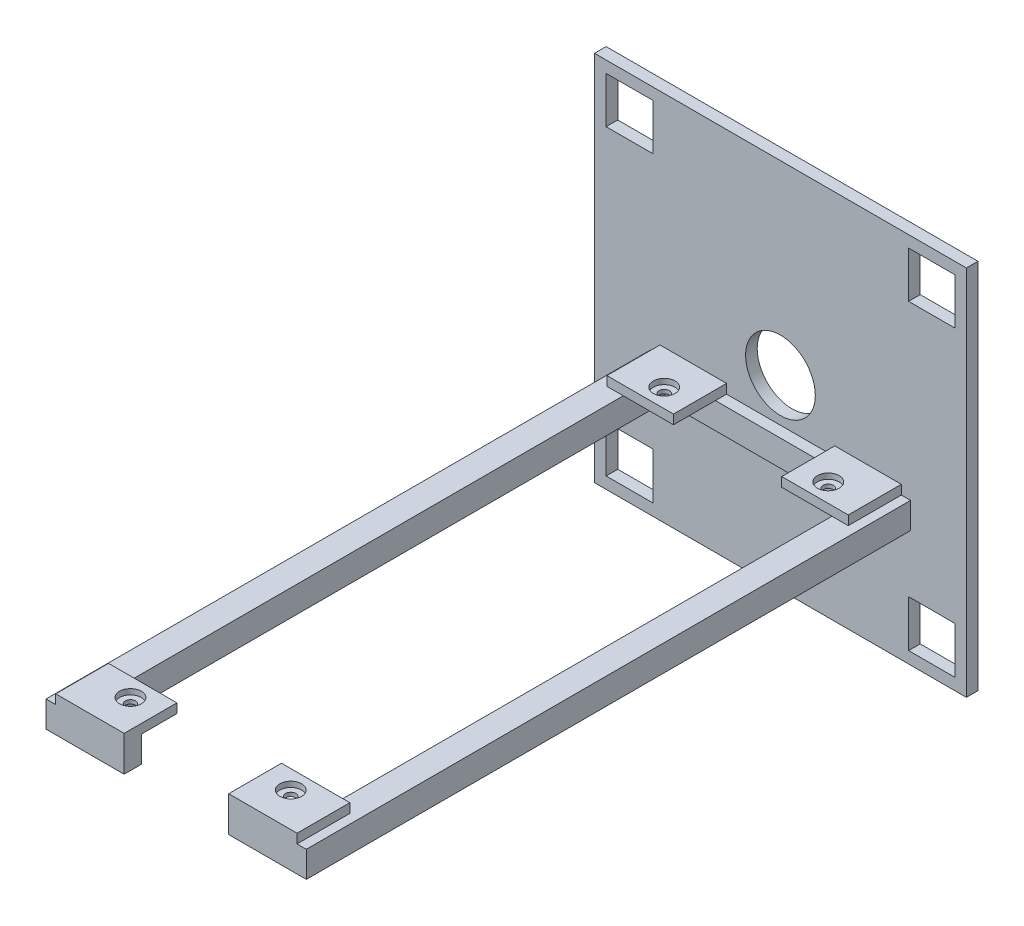
from build123d import *

# Parameters (mm, degrees)
SKETCH1_W                                           = 101.6
SKETCH1_H                                           = 101.6
BOSS_EXTRUDE1_DEPTH                                 = 3.175
SKETCH2_W                                           = 7.122890289
SKETCH2_H                                           = 7.136197002
SKETCH2_W_2                                         = 6.990922099
BOSS_EXTRUDE2_DEPTH                                 = 165.1
SKETCH3_W                                           = 57.007584612
SKETCH3_H                                           = 7.136197002
BOSS_EXTRUDE3_DEPTH                                 = 3.048
SKETCH6_W                                           = 4.833876033
SKETCH6_H                                           = 7.136197002
BOSS_EXTRUDE6_DEPTH                                 = 14.224
SKETCH7_W                                           = 4.744591934
SKETCH7_H                                           = 7.136197002
BOSS_EXTRUDE7_DEPTH                                 = 14.224
SKETCH12_W                                          = 18.683796336
SKETCH12_H                                          = 14.429225703
SKETCH12_W_2                                        = 18.700629735
SKETCH12_W_3                                        = 18.193899735
SKETCH12_H_2                                        = 14.497437443
SKETCH12_W_4                                        = 18.175923336
BOSS_EXTRUDE10_DEPTH                                = 2.54
CBORE_FOR_3_BINDING_HEAD_MACHINE_SCREW2_D           = 2.794
CBORE_FOR_3_BINDING_HEAD_MACHINE_SCREW2_CBORE_D     = 5.95376
CBORE_FOR_3_BINDING_HEAD_MACHINE_SCREW2_CBORE_DEPTH = 1.4986
SKETCH19_W                                          = 12.75921203
SKETCH19_H                                          = 12.60998148
SKETCH19_W_2                                        = 12.60998148
SKETCH19_H_2                                        = 12.75921203
CUT_EXTRUDE1_DEPTH                                  = 3.175
F_3_4_0_75_DIAMETER_HOLE1_D                         = 19.05


with BuildPart() as part:
    # Sketch1 → Boss-Extrude1 (new body)
    with BuildSketch(Plane.XY):
        with Locations((52.482861157, 13.097719286)):
            Rectangle(SKETCH1_W, SKETCH1_H)
    extrude(amount=BOSS_EXTRUDE1_DEPTH)

    # Sketch2 → Boss-Extrude2 (add)
    with BuildSketch(Plane.XY.offset(3.175)):
        with Locations((20.483036302, -2.281379215)):
            Rectangle(SKETCH2_W, SKETCH2_H)
        with Locations((84.547527108, -2.281379215)):
            Rectangle(SKETCH2_W_2, SKETCH2_H)
    extrude(amount=BOSS_EXTRUDE2_DEPTH)

    # Sketch3 → Boss-Extrude3 (add)
    with BuildSketch(Plane.XY.offset(3.175)):
        with Locations((52.548273752, -2.281379215)):
            Rectangle(SKETCH3_W, SKETCH3_H)
    extrude(amount=BOSS_EXTRUDE3_DEPTH)

    # Sketch6 → Boss-Extrude6 (add)
    with BuildSketch(Plane.ZY.offset(-81.052066058)):
        with Locations((165.858061984, -2.281379215)):
            Rectangle(SKETCH6_W, SKETCH6_H)
    extrude(amount=BOSS_EXTRUDE6_DEPTH)

    # Sketch7 → Boss-Extrude7 (add)
    with BuildSketch(Plane(origin=(24.044481446, 0, 0), x_dir=(0, 0, -1), z_dir=(1, 0, 0))):
        with Locations((-165.902704033, -2.281379215)):
            Rectangle(SKETCH7_W, SKETCH7_H)
    extrude(amount=BOSS_EXTRUDE7_DEPTH)

    # Sketch12 → Boss-Extrude10 (add)
    with BuildSketch(Plane(origin=(0, 1.286719286, 0), x_dir=(1, 0, 0), z_dir=(0, 1, 0))):
        with Locations((76.169964226, -161.060387149)):
            Rectangle(SKETCH12_W, SKETCH12_H)
        with Locations((28.918166579, -161.060387149)):
            Rectangle(SKETCH12_W_2, SKETCH12_H)
        with Locations((28.664801579, -10.423718722)):
            Rectangle(SKETCH12_W_3, SKETCH12_H_2)
        with Locations((76.423900726, -10.423718722)):
            Rectangle(SKETCH12_W_4, SKETCH12_H_2)
    extrude(amount=BOSS_EXTRUDE10_DEPTH)

    # CBORE for #3 Binding Head Machine Screw2 (through all)
    with Locations(Plane(origin=(0, 3.826719286, 0), x_dir=(1, 0, 0), z_dir=(0, 1, 0))):
        with Locations((30.648481446, -158.925774297), (74.448066058, -158.925774297), (30.141751446, -12.592437443), (74.955939058, -12.592437443)):
            CounterBoreHole(CBORE_FOR_3_BINDING_HEAD_MACHINE_SCREW2_D / 2, CBORE_FOR_3_BINDING_HEAD_MACHINE_SCREW2_CBORE_D / 2, CBORE_FOR_3_BINDING_HEAD_MACHINE_SCREW2_CBORE_DEPTH)

    # Sketch19 → Cut-Extrude1 (cut)
    with BuildSketch(Plane.XY.offset(3.175)):
        with Locations((11.237467172, 54.417728546)):
            Rectangle(SKETCH19_W, SKETCH19_H)
        with Locations((93.802870417, -28.147674699)):
            Rectangle(SKETCH19_W_2, SKETCH19_H_2)
        with Locations((93.802870417, 54.417728546)):
            Rectangle(SKETCH19_W_2, SKETCH19_H)
        with Locations((11.237467172, -28.147674699)):
            Rectangle(SKETCH19_W, SKETCH19_H_2)
    extrude(amount=-CUT_EXTRUDE1_DEPTH, mode=Mode.SUBTRACT)

    # 3/4 (0.75) Diameter Hole1 (through all)
    with Locations(Plane(origin=(0, 0, 0), x_dir=(-1, 0, 0), z_dir=(0, 0, -1))):
        with Locations((-52.482861157, 13.097719286)):
            Hole(F_3_4_0_75_DIAMETER_HOLE1_D / 2)


solid = part.part
